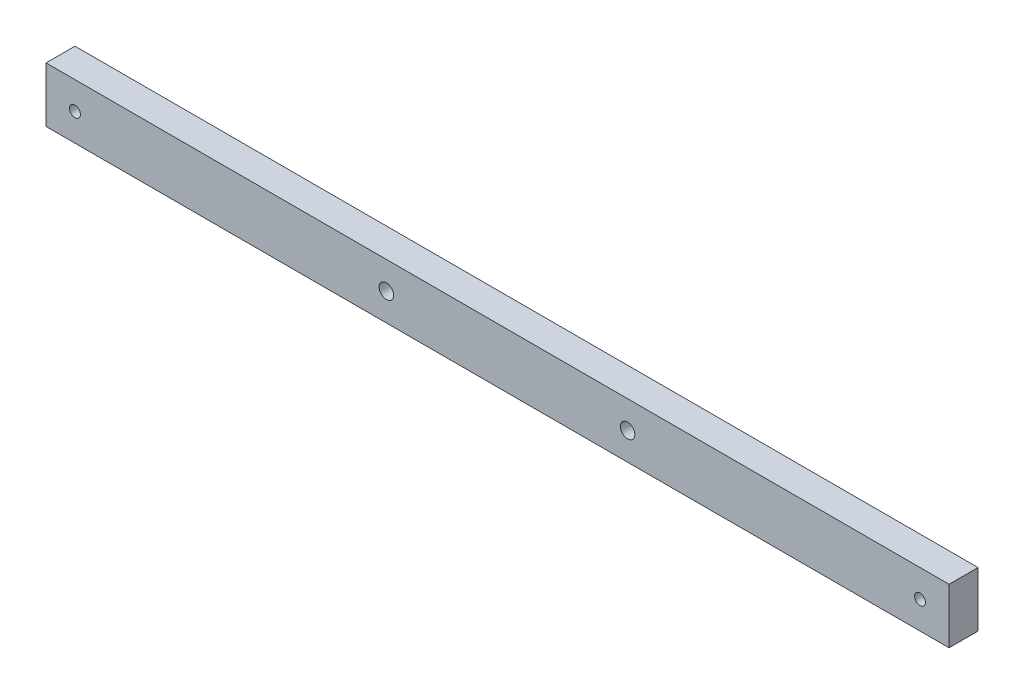
from build123d import *

# Parameters (mm, degrees)
SKETCH_2_W          = 62.35
SKETCH_2_H          = 3.8
SKETCH_2_R          = 0.5
EXTRUDE_1_DEPTH     = 2
CUT_EXTRUDE_1_REACH = 33.297
SKETCH_3_R          = 0.375


with BuildPart() as part:
    # 草图2 → 凸台-拉伸1 (new body)
    with BuildSketch(Plane.XY):
        Rectangle(SKETCH_2_W, SKETCH_2_H)
        with Locations((8.98, 0)):
            Circle(SKETCH_2_R, mode=Mode.SUBTRACT)
        with Locations((-7.675, 0)):
            Circle(SKETCH_2_R, mode=Mode.SUBTRACT)
    extrude(amount=EXTRUDE_1_DEPTH)

    # 草图3 → 切除-拉伸1 (cut, up to next)
    with BuildSketch(Plane(origin=(0, 0, 0), x_dir=(-1, 0, 0), z_dir=(0, 0, -1)), mode=Mode.PRIVATE) as cut_extrude_1_sk1:
        with Locations((29.175, 0)):
            Circle(SKETCH_3_R)
    cut_extrude_1_tool1 = extrude(cut_extrude_1_sk1.sketch, amount=-CUT_EXTRUDE_1_REACH, mode=Mode.PRIVATE) & part.part
    # 草图3 → 切除-拉伸1 (cut, up to next)
    with BuildSketch(Plane(origin=(0, 0, 0), x_dir=(-1, 0, 0), z_dir=(0, 0, -1)), mode=Mode.PRIVATE) as cut_extrude_1_sk2:
        with Locations((-29.175, 0)):
            Circle(SKETCH_3_R)
    cut_extrude_1_tool2 = extrude(cut_extrude_1_sk2.sketch, amount=-CUT_EXTRUDE_1_REACH, mode=Mode.PRIVATE) & part.part
    add(cut_extrude_1_tool1.solids().sort_by_distance((-29.175, 0, 0))[0], mode=Mode.SUBTRACT)
    add(cut_extrude_1_tool2.solids().sort_by_distance((29.175, 0, 0))[0], mode=Mode.SUBTRACT)


solid = part.part
